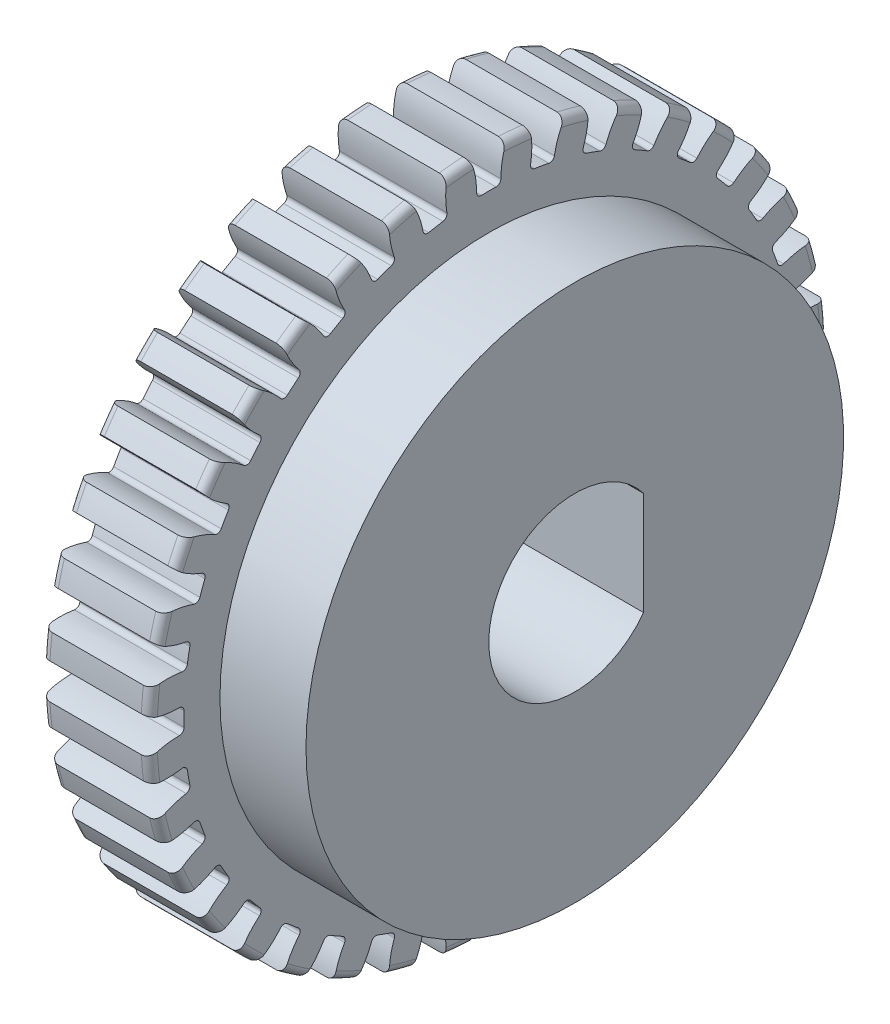
from build123d import *

# Parameters (mm, degrees)
FILLET1_R                = 0.238125
FILLET2_R                = 0.140797899
CIRPATTERN4_COUNT        = 36
FILLET2_OF_CIRPATTERN4_R = 0.140797899
CUT_EXTRUDE2_START       = -3.81
SKETCH15_R               = 7.9375
CUT_EXTRUDE2_DEPTH       = 3.81
BOSS_EXTRUDE2_START      = -5.715
BOSS_EXTRUDE2_OUTLINE_R  = 2.38125
BOSS_EXTRUDE2_DEPTH      = 5.715
CUT_EXTRUDE3_DEPTH       = 16.278602588


# Read off the part's stored shape, not the designer's step: Boss-Extrude2
with BuildPart() as part:
    # Sketch12 → Revolve3 (revolve)
    with BuildSketch(Plane.XY, mode=Mode.PRIVATE) as revolve3_sk:
        Polygon((-4.7625, 10.033), (-4.7625, 2.38125), (4.7625, 2.38125), (4.7625, 7.9375), (-1.5875, 7.9375), (-1.5875, 10.033), align=None)
    revolve(revolve3_sk.sketch.rotate(Axis((0, 0, 0), (1, 0, 0)), 90), axis=Axis((0, 0, 0), (1, 0, 0)))

    # Fillet1
    fillet1_edges = [part.edges().sort_by_distance(p)[0] for p in [
        (-4.7625, 0, -10.033),
        (-1.5875, 0, -10.033),
    ]]
    fillet(fillet1_edges, radius=FILLET1_R)

    # Cut-Sweep1: sweep along a path in Sketch7
    with BuildLine(Plane.XY) as cut_sweep1_path:
        Line((-4.7625, 0), (-1.5875, 0))
    # Sketch6 → Cut-Sweep1 (sweep, cut)
    with BuildSketch(Plane(origin=(-4.7625, 0, 0), x_dir=(0, 0, -1), z_dir=(-1, 0, 0))):
        with BuildLine():
            Line((-8.995548423, -0.351994747), (-9.256632348, -0.36221093))
            ThreePointArc((-9.256632348, -0.36221093), (-9.644812546, -0.41045004), (-10.019342965, -0.523312097))
            ThreePointArc((-10.019342965, -0.523312097), (-10.033, 0), (-10.019342965, 0.523312097))
            ThreePointArc((-10.019342965, 0.523312097), (-9.644812546, 0.41045004), (-9.256632348, 0.36221093))
            Line((-9.256632348, 0.36221093), (-8.995548423, 0.351994747))
            ThreePointArc((-8.995548423, 0.351994747), (-9.002432545, 0), (-8.995548423, -0.351994747))
        make_face()
    cut_sweep1 = sweep(path=cut_sweep1_path.line, mode=Mode.SUBTRACT)

    # Fillet2
    fillet2_edges = [part.edges().sort_by_distance(p)[0] for p in [
        (-3.175, -0.351994747, 8.995548423),
        (-3.175, 0.351994747, 8.995548423),
    ]]
    fillet(fillet2_edges, radius=FILLET2_R)

    # CirPattern4: Cut-Sweep1 ×36 about axis
    cirpattern4_axis = Axis((0, 0, 0), (1, 0, 0))
    for i in range(1, CIRPATTERN4_COUNT):
        add(cut_sweep1.rotate(cirpattern4_axis, i * 360 / CIRPATTERN4_COUNT), mode=Mode.SUBTRACT)

    # Fillet2 of CirPattern4
    fillet2_of_cirpattern4_edges = [part.edges().sort_by_distance(p)[0] for p in [
        (-3.175, -1.908707747, 8.797762583),
        (-3.175, -1.215413435, 8.920009076),
        (-3.175, -3.407425627, 8.332661179),
        (-3.175, -2.745891895, 8.573439767),
        (-3.175, -4.802610604, 7.614376082),
        (-3.175, -4.192937819, 7.966370829),
        (-3.175, -6.051870688, 6.66473202),
        (-3.175, -5.512583449, 7.117247744),
        (-3.175, -7.117247744, 5.512583449),
        (-3.175, -6.66473202, 6.051870688),
        (-3.175, -7.966370829, 4.192937819),
        (-3.175, -7.614376082, 4.802610604),
        (-3.175, -8.573439767, 2.745891895),
        (-3.175, -8.332661179, 3.407425627),
        (-3.175, -8.920009076, 1.215413435),
        (-3.175, -8.797762583, 1.908707747),
        (-3.175, -8.995548423, -0.351994747),
        (-3.175, -8.995548423, 0.351994747),
        (-3.175, -8.797762583, -1.908707747),
        (-3.175, -8.920009076, -1.215413435),
        (-3.175, -8.332661179, -3.407425627),
        (-3.175, -8.573439767, -2.745891895),
        (-3.175, -7.614376082, -4.802610604),
        (-3.175, -7.966370829, -4.192937819),
        (-3.175, -6.66473202, -6.051870688),
        (-3.175, -7.117247744, -5.512583449),
        (-3.175, -5.512583449, -7.117247744),
        (-3.175, -6.051870688, -6.66473202),
        (-3.175, -4.192937819, -7.966370829),
        (-3.175, -4.802610604, -7.614376082),
        (-3.175, -2.745891895, -8.573439767),
        (-3.175, -3.407425627, -8.332661179),
        (-3.175, -1.215413435, -8.920009076),
        (-3.175, -1.908707747, -8.797762583),
        (-3.175, 0.351994747, -8.995548423),
        (-3.175, -0.351994747, -8.995548423),
        (-3.175, 1.908707747, -8.797762583),
        (-3.175, 1.215413435, -8.920009076),
        (-3.175, 3.407425627, -8.332661179),
        (-3.175, 2.745891895, -8.573439767),
        (-3.175, 4.802610604, -7.614376082),
        (-3.175, 4.192937819, -7.966370829),
        (-3.175, 6.051870688, -6.66473202),
        (-3.175, 5.512583449, -7.117247744),
        (-3.175, 7.117247744, -5.512583449),
        (-3.175, 6.66473202, -6.051870688),
        (-3.175, 7.966370829, -4.192937819),
        (-3.175, 7.614376082, -4.802610604),
        (-3.175, 8.573439767, -2.745891895),
        (-3.175, 8.332661179, -3.407425627),
        (-3.175, 8.920009076, -1.215413435),
        (-3.175, 8.797762583, -1.908707747),
        (-3.175, 8.995548423, 0.351994747),
        (-3.175, 8.995548423, -0.351994747),
        (-3.175, 8.797762583, 1.908707747),
        (-3.175, 8.920009076, 1.215413435),
        (-3.175, 8.332661179, 3.407425627),
        (-3.175, 8.573439767, 2.745891895),
        (-3.175, 7.614376082, 4.802610604),
        (-3.175, 7.966370829, 4.192937819),
        (-3.175, 6.66473202, 6.051870688),
        (-3.175, 7.117247744, 5.512583449),
        (-3.175, 5.512583449, 7.117247744),
        (-3.175, 6.051870688, 6.66473202),
        (-3.175, 4.192937819, 7.966370829),
        (-3.175, 4.802610604, 7.614376082),
        (-3.175, 2.745891895, 8.573439767),
        (-3.175, 3.407425627, 8.332661179),
        (-3.175, 1.215413435, 8.920009076),
        (-3.175, 1.908707747, 8.797762583),
    ]]
    fillet(fillet2_of_cirpattern4_edges, radius=FILLET2_OF_CIRPATTERN4_R)

    # Sketch15 → Cut-Extrude2 (cut)
    with BuildSketch(Plane(origin=(4.7625, 0, 0), x_dir=(0, 0, -1), z_dir=(1, 0, 0)).offset(CUT_EXTRUDE2_START)):
        with Locations(Location((0, 0, 0), (0, 0, 180))):
            Circle(SKETCH15_R)
    extrude(amount=CUT_EXTRUDE2_DEPTH, mode=Mode.SUBTRACT)

    # Boss-Extrude2 outline → Boss-Extrude2 (add)
    with BuildSketch(Plane(origin=(0.9525, 0, 0), x_dir=(0, 0, -1), z_dir=(1, 0, 0)).offset(BOSS_EXTRUDE2_START)):
        Circle(BOSS_EXTRUDE2_OUTLINE_R)
    extrude(amount=BOSS_EXTRUDE2_DEPTH)

    # Sketch18 → Cut-Extrude3 (cut, through all)
    with BuildSketch(Plane(origin=(0.9525, 0, 0), x_dir=(0, 0, -1), z_dir=(1, 0, 0))):
        with BuildLine():
            Line((2.032, 1.524), (2.032, -1.524))
            ThreePointArc((2.032, -1.524), (-2.54, 0), (2.032, 1.524))
        make_face()
    extrude(amount=-CUT_EXTRUDE3_DEPTH, mode=Mode.SUBTRACT)


solid = part.part
